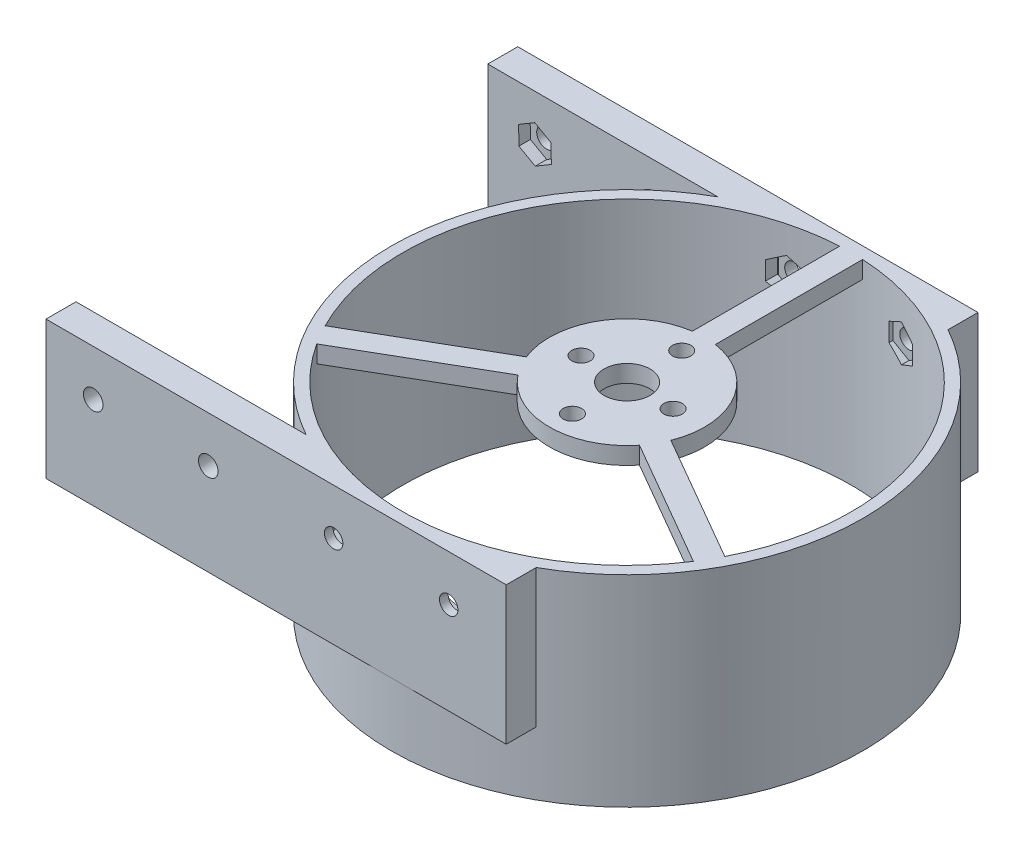
from build123d import *

# Parameters (mm, degrees)
SKETCH_1_R               = 41
SKETCH_1_R_2             = 39
EXTRUDE_1_DEPTH          = 20
EXTRUDE_START            = -14
EXTRUDE_2_DEPTH          = 14
EXTRUDE_START_2          = -3
SKETCH_3_R               = 4
SKETCH_3_R_2             = 1.6
EXTRUDE_3_DEPTH          = 3
CUT_EXTRUDE_3_DEPTH      = 3
EXTRUDE_5_DEPTH          = 10
EXTRUDE_5_DEPTH_BACK     = 15
SKETCH_1_2_R             = 41
SKETCH_1_2_R_2           = 39
EXTRUDE_START_3          = 10
EXTRUDE_7_DEPTH          = 10
EXTRUDE_8_DEPTH          = 10
EXTRUDE_8_DEPTH_BACK     = 5
CUT_EXTRUDE_4_DEPTH      = 80
EXTRUDE_START_4          = -24
EXTRUDE_10_DEPTH         = 24
EXTRUDE_9_DEPTH          = 10
EXTRUDE_9_DEPTH_BACK     = 1.5
CUT_EXTRUDE_6_DEPTH      = 10
SKETCH_16_R              = 1.6
CUT_EXTRUDE_7_DEPTH      = 103
SKETCH_18_R              = 1.6
CUT_EXTRUDE_8_DEPTH      = 10
SKETCH_18_4_R            = 1.6
CUT_EXTRUDE_9_DEPTH      = 10
SKETCH_21_W              = 5.208939664
SKETCH_21_H              = 24
EXTRUDE_11_DEPTH         = 40
SKETCH_22_W              = 5.208939664
SKETCH_22_H              = 24
EXTRUDE_12_DEPTH         = 40
SKETCH_23_R              = 1.7
CUT_EXTRUDE_10_DEPTH     = 10
CUT_EXTRUDE_START        = -2
SKETCH_24_R              = 1.7
CUT_EXTRUDE_11_DEPTH     = 2
MIRROR_START             = -2
MIRROR_2_COPY_1_SKETCH_R = 1.7
MIRROR_2_COPY_1_DEPTH    = 2


with BuildPart() as part:
    # 草图1 → 凸台-拉伸1 (new body)
    with BuildSketch(Plane(origin=(0, 0, 0), x_dir=(1, 0, 0), z_dir=(0, 1, 0))):
        Circle(SKETCH_1_R)
        Circle(SKETCH_1_R_2, mode=Mode.SUBTRACT)
    extrude(amount=EXTRUDE_1_DEPTH)

    # 草图2 → 凸台-拉伸2 (add)
    with BuildSketch(Plane(origin=(0, 20, 0), x_dir=(1, 0, 0), z_dir=(0, 1, 0)).offset(EXTRUDE_START)):
        with BuildLine():
            Line((3.5e-08, -41), (20, -41))
            Line((20, -41), (20, -35.791060336))
            ThreePointArc((20, -35.791060336), (10.333598766, -39.676400247), (3.5e-08, -41))
        make_face()
        with BuildLine():
            Line((-20, -41), (3.5e-08, -41))
            ThreePointArc((3.5e-08, -41), (-10.333598732, -39.676400256), (-20, -35.791060336))
            Line((-20, -35.791060336), (-20, -41))
        make_face()
    extrude(amount=EXTRUDE_2_DEPTH)

    # 草图3 → 凸台-拉伸3 (add)
    with BuildSketch(Plane(origin=(0, 20, 0), x_dir=(1, 0, 0), z_dir=(0, 1, 0)).offset(EXTRUDE_START_2)):
        with BuildLine():
            Line((-2, 38.948684188), (-2, 13.351029923))
            ThreePointArc((-2, 13.351029923), (-11.691342951, 6.75), (-12.56233108, -4.943464154))
            Line((-12.56233108, -4.943464154), (-34.730549951, -17.742291287))
            ThreePointArc((-34.730549951, -17.742291287), (-33.774990748, -19.5), (-32.730549951, -21.206392902))
            Line((-32.730549951, -21.206392902), (-10.56233108, -8.407565769))
            ThreePointArc((-10.56233108, -8.407565769), (0, -13.5), (10.56233108, -8.407565769))
            Line((10.56233108, -8.407565769), (32.730549951, -21.206392902))
            ThreePointArc((32.730549951, -21.206392902), (33.774990748, -19.5), (34.730549951, -17.742291287))
            Line((34.730549951, -17.742291287), (12.56233108, -4.943464154))
            ThreePointArc((12.56233108, -4.943464154), (11.691342951, 6.75), (2, 13.351029923))
            Line((2, 13.351029923), (2, 38.948684188))
            ThreePointArc((2, 38.948684188), (0, 39), (-2, 38.948684188))
        make_face()
        Circle(SKETCH_3_R, mode=Mode.SUBTRACT)
        with Locations((-8, 0)):
            Circle(SKETCH_3_R_2, mode=Mode.SUBTRACT)
        with Locations((8, 0)):
            Circle(SKETCH_3_R_2, mode=Mode.SUBTRACT)
    extrude(amount=EXTRUDE_3_DEPTH)

    # 草图7 → 切除-拉伸3 (cut)
    with BuildSketch(Plane.XZ.offset(-6)):
        with BuildLine():
            Line((0, 41), (-20, 41))
            Line((-20, 41), (-20, 35.791060336))
            ThreePointArc((-20, 35.791060336), (-10.333598749, 39.676400251), (0, 41))
        make_face()
        with BuildLine():
            Line((20, 41), (0, 41))
            ThreePointArc((0, 41), (10.333598749, 39.676400251), (20, 35.791060336))
            Line((20, 35.791060336), (20, 41))
        make_face()
    extrude(amount=-CUT_EXTRUDE_3_DEPTH, mode=Mode.SUBTRACT)

    # 草图1<2> → 凸台-拉伸5 (add, two sides: drawn at the far end of the back side and taken through both)
    with BuildSketch(Plane(origin=(0, 0, 0), x_dir=(1, 0, 0), z_dir=(0, 1, 0)).offset(-EXTRUDE_5_DEPTH_BACK)):
        Circle(SKETCH_1_2_R)
        Circle(SKETCH_1_2_R_2, mode=Mode.SUBTRACT)
    extrude(amount=EXTRUDE_5_DEPTH + EXTRUDE_5_DEPTH_BACK)

    # 草图7<4> → 凸台-拉伸7 (add)
    with BuildSketch(Plane.XZ.offset(-6).offset(EXTRUDE_START_3)):
        with BuildLine():
            Line((0, 41), (-20, 41))
            Line((-20, 41), (-20, 35.791060336))
            ThreePointArc((-20, 35.791060336), (-10.333598749, 39.676400251), (0, 41))
        make_face()
        with BuildLine():
            Line((20, 41), (0, 41))
            ThreePointArc((0, 41), (10.333598749, 39.676400251), (20, 35.791060336))
            Line((20, 35.791060336), (20, 41))
        make_face()
    extrude(amount=-EXTRUDE_7_DEPTH)

    # 草图7<5> → 凸台-拉伸8 (add, two sides: drawn at the far end of the back side and taken through both)
    with BuildSketch(Plane.XZ.offset(-6).offset(-EXTRUDE_8_DEPTH_BACK)):
        with BuildLine():
            Line((0, 41), (-20, 41))
            Line((-20, 41), (-20, 35.791060336))
            ThreePointArc((-20, 35.791060336), (-10.333598749, 39.676400251), (0, 41))
        make_face()
        with BuildLine():
            Line((20, 41), (0, 41))
            ThreePointArc((0, 41), (10.333598749, 39.676400251), (20, 35.791060336))
            Line((20, 35.791060336), (20, 41))
        make_face()
    extrude(amount=EXTRUDE_8_DEPTH + EXTRUDE_8_DEPTH_BACK)

    # 草图4 → 切除-拉伸4 (cut)
    with BuildSketch(Plane.XY.offset(41)):
        Polygon((-10, 8.766838493), (-7.2, 10.383419246), (-7.2, 13.616580754), (-10, 15.233161507), (-12.8, 13.616580754), (-12.8, 10.383419246), align=None)
        Polygon((12.8, 10.383419246), (10, 8.766838493), (7.2, 10.383419246), (7.2, 13.616580754), (10, 15.233161507), (12.8, 13.616580754), align=None)
    extrude(amount=-CUT_EXTRUDE_4_DEPTH, mode=Mode.SUBTRACT)

    # 草图20 → 凸台-拉伸10 (add)
    with BuildSketch(Plane(origin=(0, 20, 0), x_dir=(1, 0, 0), z_dir=(0, 1, 0)).offset(EXTRUDE_START_4)):
        with BuildLine():
            Line((20, 41), (1.85e-07, 41))
            ThreePointArc((1.85e-07, 41), (10.333598839, 39.676400228), (20, 35.791060336))
            Line((20, 35.791060336), (20, 41))
        make_face()
        with BuildLine():
            Line((-20, 41), (-20, 35.791060336))
            ThreePointArc((-20, 35.791060336), (-10.333598659, 39.676400275), (1.85e-07, 41))
            Line((1.85e-07, 41), (-20, 41))
        make_face()
    extrude(amount=EXTRUDE_10_DEPTH)

    # 草图4<3> → 凸台-拉伸9 (add, two sides: drawn at the far end of the back side and taken through both)
    with BuildSketch(Plane.XY.offset(41).offset(-EXTRUDE_9_DEPTH_BACK)):
        Polygon((-10, 8.766838493), (-7.2, 10.383419246), (-7.2, 13.616580754), (-10, 15.233161507), (-12.8, 13.616580754), (-12.8, 10.383419246), align=None)
        Polygon((12.8, 10.383419246), (10, 8.766838493), (7.2, 10.383419246), (7.2, 13.616580754), (10, 15.233161507), (12.8, 13.616580754), align=None)
    extrude(amount=EXTRUDE_9_DEPTH + EXTRUDE_9_DEPTH_BACK)

    # 草图13 → 切除-拉伸6 (cut)
    with BuildSketch(Plane.XY.offset(51)):
        Polygon((10, 15.233161507), (7.2, 13.616580754), (7.2, 10.383419246), (10, 8.766838493), (12.8, 10.383419246), (12.8, 13.616580754), align=None)
        Polygon((-10, 15.233161507), (-12.8, 13.616580754), (-12.8, 10.383419246), (-10, 8.766838493), (-7.2, 10.383419246), (-7.2, 13.616580754), align=None)
    extrude(amount=-CUT_EXTRUDE_6_DEPTH, mode=Mode.SUBTRACT)

    # 草图16 → 切除-拉伸7 (cut)
    with BuildSketch(Plane.XY.offset(41)):
        with Locations((-10, 12)):
            Circle(SKETCH_16_R)
        with Locations((10, 12)):
            Circle(SKETCH_16_R)
    extrude(amount=-CUT_EXTRUDE_7_DEPTH, mode=Mode.SUBTRACT)

    # 草图18 → 切除-拉伸8 (cut)
    with BuildSketch(Plane(origin=(0, 20, 0), x_dir=(1, 0, 0), z_dir=(0, 1, 0))):
        with Locations((0, 9.5)):
            Circle(SKETCH_18_R)
    extrude(amount=-CUT_EXTRUDE_8_DEPTH, mode=Mode.SUBTRACT)

    # 草图18<4> → 切除-拉伸9 (cut)
    with BuildSketch(Plane(origin=(0, 20, 0), x_dir=(1, 0, 0), z_dir=(0, 1, 0))):
        with Locations((0, 9.5)):
            Circle(SKETCH_18_4_R)
        with Locations((0, -9.5)):
            Circle(SKETCH_18_4_R)
    extrude(amount=-CUT_EXTRUDE_9_DEPTH, mode=Mode.SUBTRACT)

    # 草图21 → 凸台-拉伸11 (add)
    with BuildSketch(Plane.ZY.offset(20)):
        with Locations((38.395530168, 8)):
            Rectangle(SKETCH_21_W, SKETCH_21_H)
    extrude(amount=EXTRUDE_11_DEPTH)

    # 草图22 → 凸台-拉伸12 (add)
    with BuildSketch(Plane.ZY.offset(20)):
        with Locations((-38.395530168, 8)):
            Rectangle(SKETCH_22_W, SKETCH_22_H)
    extrude(amount=EXTRUDE_12_DEPTH)

    # 草图23 → 切除-拉伸10 (cut)
    with BuildSketch(Plane.XY.offset(41)):
        with Locations((-51.796444508, 12)):
            Circle(SKETCH_23_R)
        with Locations((-31.796444508, 12)):
            Circle(SKETCH_23_R)
    cut_extrude_10 = extrude(amount=-CUT_EXTRUDE_10_DEPTH, mode=Mode.SUBTRACT)

    # 草图24 → 切除-拉伸11 (cut)
    # profile 1 of 2: a face of its own
    with BuildSketch(Plane(origin=(0, 0, 35.791060336), x_dir=(-1, 0, 0), z_dir=(0, 0, -1)).offset(CUT_EXTRUDE_START)):
        Polygon((28.996444508, 10.340970788), (31.833205951, 8.745614264), (34.633205951, 10.404643475), (34.596444508, 13.659029212), (31.759683065, 15.254385736), (28.959683065, 13.595356525), align=None)
        with Locations((31.796444508, 12)):
            Circle(SKETCH_24_R, mode=Mode.SUBTRACT)
    # profile 2 of 2: a face of its own
    with BuildSketch(Plane(origin=(0, 0, 35.791060336), x_dir=(-1, 0, 0), z_dir=(0, 0, -1)).offset(CUT_EXTRUDE_START)):
        Polygon((51.759683065, 8.745614264), (54.596444508, 10.340970788), (54.633205951, 13.595356525), (51.833205951, 15.254385736), (48.996444508, 13.659029212), (48.959683065, 10.404643475), align=None)
        with Locations((51.796444508, 12)):
            Circle(SKETCH_24_R, mode=Mode.SUBTRACT)
    cut_extrude_11 = extrude(amount=CUT_EXTRUDE_11_DEPTH, mode=Mode.SUBTRACT)

    # 镜向1: 切除-拉伸11 across plane
    add(cut_extrude_11.mirror(Plane(origin=(0, 0, 0), x_dir=(1, 0, 0), z_dir=(0, 0, -1))), mode=Mode.SUBTRACT)

    # 镜向2: 切除-拉伸10, 切除-拉伸11 across plane
    add(cut_extrude_10.mirror(Plane(origin=(0, 0, 0), x_dir=(1, 0, 0), z_dir=(0, 0, -1))), mode=Mode.SUBTRACT)
    add(cut_extrude_11.mirror(Plane(origin=(0, 0, 0), x_dir=(1, 0, 0), z_dir=(0, 0, -1))), mode=Mode.SUBTRACT)

    # 镜向2 copy 1 sketch → 镜向2 copy 1 (cut)
    # profile 1 of 2: a face of its own
    with BuildSketch(Plane(origin=(0, 0, 35.791060336), x_dir=(-1, 0, 0), z_dir=(0, 0, -1)).offset(MIRROR_START)):
        Polygon((28.996444508, 10.340970788), (31.833205951, 8.745614264), (34.633205951, 10.404643475), (34.596444508, 13.659029212), (31.759683065, 15.254385736), (28.959683065, 13.595356525), align=None)
        with Locations((31.796444508, 12)):
            Circle(MIRROR_2_COPY_1_SKETCH_R, mode=Mode.SUBTRACT)
    # profile 2 of 2: a face of its own
    with BuildSketch(Plane(origin=(0, 0, 35.791060336), x_dir=(-1, 0, 0), z_dir=(0, 0, -1)).offset(MIRROR_START)):
        Polygon((51.759683065, 8.745614264), (54.596444508, 10.340970788), (54.633205951, 13.595356525), (51.833205951, 15.254385736), (48.996444508, 13.659029212), (48.959683065, 10.404643475), align=None)
        with Locations((51.796444508, 12)):
            Circle(MIRROR_2_COPY_1_SKETCH_R, mode=Mode.SUBTRACT)
    extrude(amount=MIRROR_2_COPY_1_DEPTH, mode=Mode.SUBTRACT)


solid = part.part
